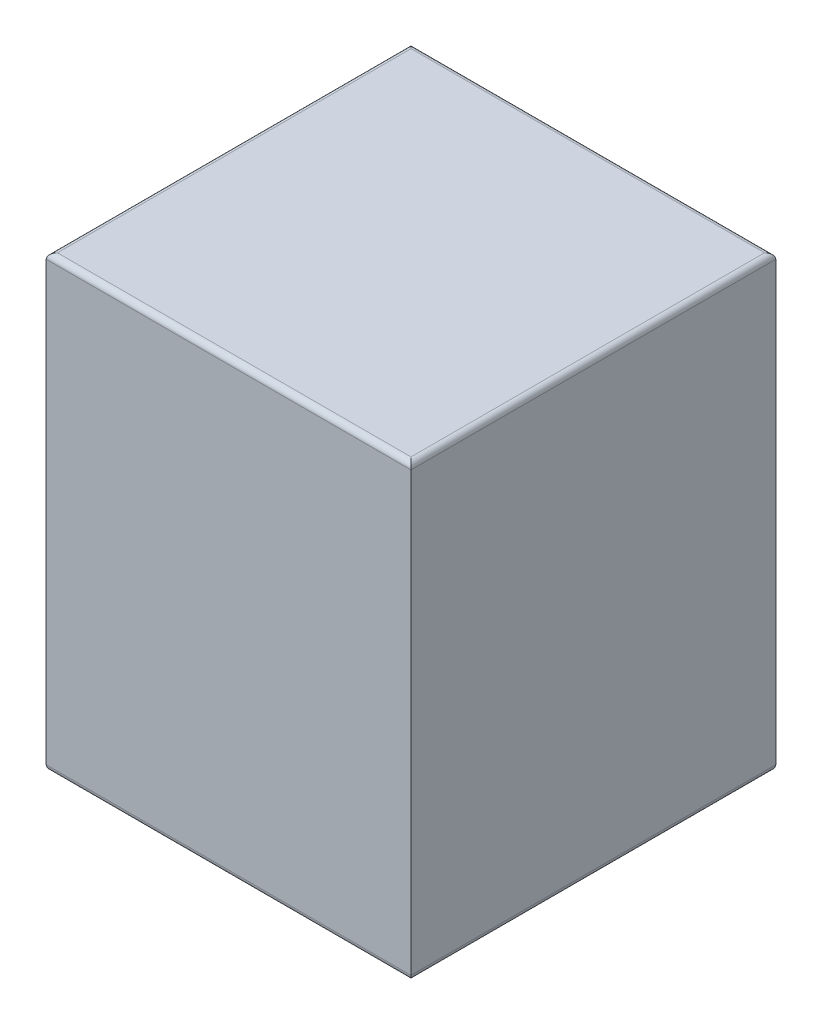
from build123d import *

# Parameters (mm, degrees)
SKETCH1_W           = 32.5
SKETCH1_H           = 32.5
BOSS_EXTRUDE1_DEPTH = 40
FILLET1_R           = 0.5


with BuildPart() as part:
    # Sketch1 → Boss-Extrude1 (new body)
    with BuildSketch(Plane(origin=(0, 0, 0), x_dir=(1, 0, 0), z_dir=(0, 1, 0))):
        Rectangle(SKETCH1_W, SKETCH1_H)
    extrude(amount=BOSS_EXTRUDE1_DEPTH)

    # Fillet1
    fillet1_edges = [part.edges().sort_by_distance(p)[0] for p in [
        (0, 0, 16.25),
        (16.25, 0, 0),
        (0, 0, -16.25),
        (-16.25, 0, 0),
        (0, 40, -16.25),
        (16.25, 40, 0),
        (0, 40, 16.25),
        (-16.25, 40, 0),
    ]]
    fillet(fillet1_edges, radius=FILLET1_R)


solid = part.part
